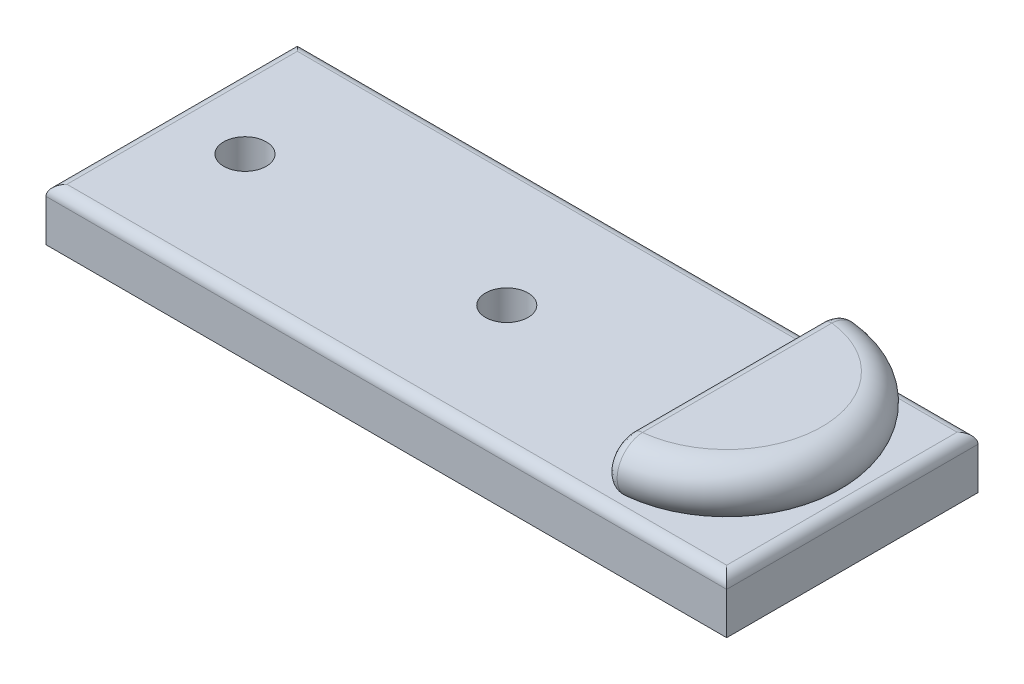
from build123d import *

# Parameters (mm, degrees)
SKETCH1_W           = 65
SKETCH1_H           = 24
BOSS_EXTRUDE1_DEPTH = 5
REVOLVE1_OUTLINE_R  = 1.5
REVOLVE1_ANGLE      = 180
SKETCH4_R           = 2.03
CUT_EXTRUDE1_DEPTH  = 5
FILLET1_R           = 1
FILLET2_R           = 1


# Read off the part's stored shape, not the designer's step: Revolve1
with BuildPart() as part:
    # Sketch1 → Boss-Extrude1 (new body)
    with BuildSketch(Plane(origin=(0, 0, 0), x_dir=(1, 0, 0), z_dir=(0, 1, 0))):
        with Locations((32.5, 12)):
            Rectangle(SKETCH1_W, SKETCH1_H)
    extrude(amount=BOSS_EXTRUDE1_DEPTH)

    # Sketch4 → Cut-Extrude1 (cut)
    with BuildSketch(Plane(origin=(0, 5, 0), x_dir=(1, 0, 0), z_dir=(0, 1, 0))):
        with Locations(Location((32, 12, 0), (0, 0, 270))):
            Circle(SKETCH4_R)
        with Locations(Location((7, 12, 0), (0, 0, 270))):
            Circle(SKETCH4_R)
    extrude(amount=-CUT_EXTRUDE1_DEPTH, mode=Mode.SUBTRACT)

    # Fillet2
    fillet2_edges = [part.edges().sort_by_distance(p)[0] for p in [
        (65, 5, -12),
        (32.5, 5, 0),
        (0, 5, -12),
        (32.5, 5, -24),
    ]]
    fillet(fillet2_edges, radius=FILLET2_R)


with BuildPart() as body_2:
    # Revolve1 outline → Revolve1 (revolve)
    with BuildSketch(Plane(origin=(53, 0, -12), x_dir=(0, 0, 1), z_dir=(-1, 0, 0))):
        with BuildLine():
            Line((0, 5), (9.10321303, 5))
            ThreePointArc((9.10321303, 5), (11.60321303, 7.5), (9.10321303, 10))
            Line((9.10321303, 10), (0, 10))
            Line((0, 10), (0, 5))
        make_face()
        with Locations((7.10321303, 7.5)):
            Circle(REVOLVE1_OUTLINE_R, mode=Mode.SUBTRACT)
    revolve(axis=Axis((53, 0, -12), (0, 1, 0)), revolution_arc=REVOLVE1_ANGLE)

    # Fillet1
    fillet1_edges = [body_2.edges().sort_by_distance(p)[0] for p in [
        (53, 10, -12),
        (53, 5, -12),
        (53, 7.5, -23.60321303),
        (53, 7.5, -0.39678697),
    ]]
    fillet(fillet1_edges, radius=FILLET1_R - 0.0001)  # a hair under: the kernel refuses the full size


solid = Compound([part.part, body_2.part])
